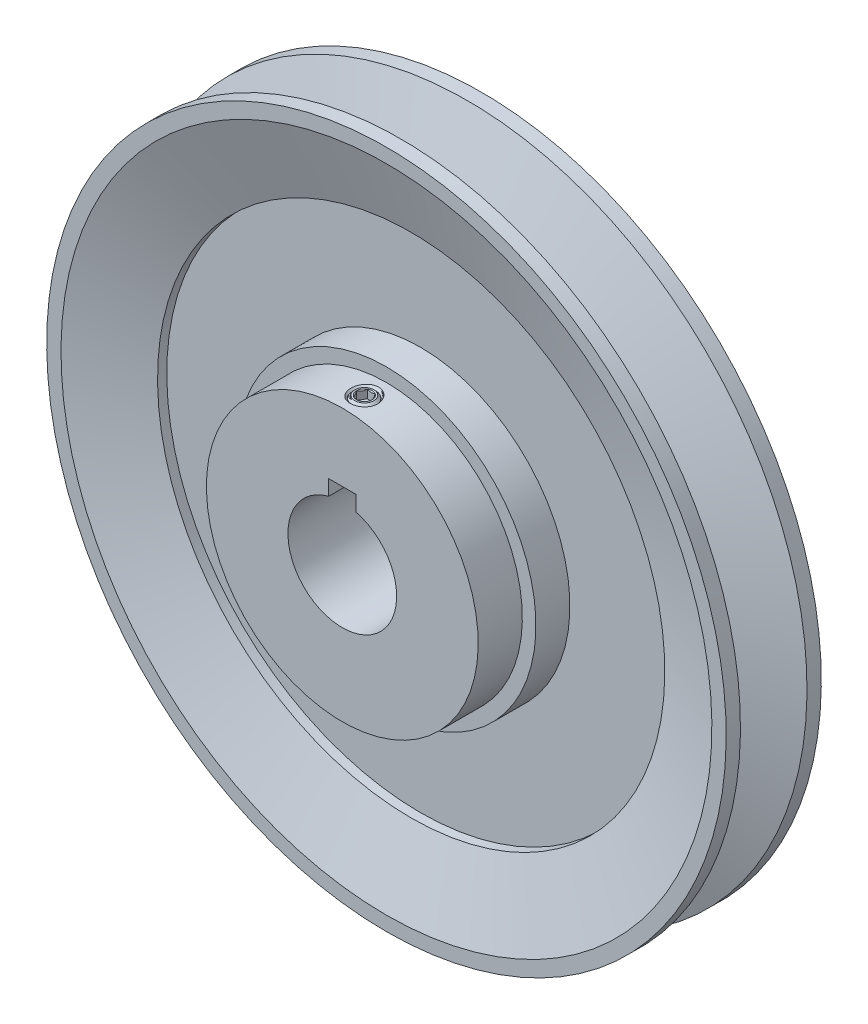
from build123d import *

# Parameters (mm, degrees)
SKETCH2_W          = 10.31875
SKETCH2_H          = 31.75
SKETCH3_R          = 12.7
CUT_EXTRUDE1_DEPTH = 32.5374
SKETCH4_W          = 6.35
SKETCH4_H          = 6.35
CUT_EXTRUDE2_DEPTH = 32.5374
SKETCH5_R          = 2.38125
CUT_EXTRUDE3_DEPTH = 31.75
CUT_SWEEP1_PITCH   = 1.27
CUT_SWEEP2_PITCH   = 1.27
CUT_EXTRUDE5_DEPTH = 1.984375


with BuildPart() as part:
    # Sketch1 → Revolve1 (revolve)
    with BuildSketch(Plane(origin=(0, 0, 0), x_dir=(0, 0, -1), z_dir=(1, 0, 0)), mode=Mode.PRIVATE) as revolve1_sk:
        Polygon((7.7724, 79.375), (11.1125, 79.375), (11.1125, 76.0349), (5.334525365, 59.254443213), (3.175, 59.254443213), (3.175, 34.925), (7.94385, 34.925), (7.94385, 0), (-11.1125, 0), (-11.1125, 34.925), (-3.175, 34.925), (-3.175, 59.254443213), (-5.334525365, 59.254443213), (-11.1125, 76.0349), (-11.1125, 79.375), (-7.7724, 79.375), (-2.306199139, 63.5), (2.306199139, 63.5), align=None)
    revolve(revolve1_sk.sketch.rotate(Axis((0, 0, 21.4249), (0, 0, -1)), 180), axis=Axis((0, 0, 21.4249), (0, 0, -1)))

    # Sketch2 → Revolve2 (revolve)
    with BuildSketch(Plane(origin=(0, 0, 0), x_dir=(0, 0, -1), z_dir=(1, 0, 0))):
        with Locations((-16.265525, 15.875)):
            Rectangle(SKETCH2_W, SKETCH2_H)
    revolve(axis=Axis((0, 0, -11.1125), (0, 0, 1)))

    # Sketch3 → Cut-Extrude1 (cut)
    with BuildSketch(Plane(origin=(0, 0, 21.4249), x_dir=(-1, 0, 0), z_dir=(0, 0, -1))):
        with Locations(Location((0, 0, 0), (0, 0, 270))):
            Circle(SKETCH3_R)
    extrude(amount=CUT_EXTRUDE1_DEPTH, mode=Mode.SUBTRACT)

    # Sketch4 → Cut-Extrude2 (cut)
    with BuildSketch(Plane(origin=(0, 0, 21.4249), x_dir=(-1, 0, 0), z_dir=(0, 0, -1))):
        with Locations((0, 12.7)):
            Rectangle(SKETCH4_W, SKETCH4_H)
    extrude(amount=CUT_EXTRUDE2_DEPTH, mode=Mode.SUBTRACT)

    # Sketch5 → Cut-Extrude3 (cut)
    with BuildSketch(Plane(origin=(0, 31.75, 0), x_dir=(-1, 0, 0), z_dir=(0, 1, 0))):
        with Locations(Location((0, 16.265525, 0), (0, 0, 270))):
            Circle(SKETCH5_R)
    extrude(amount=-CUT_EXTRUDE3_DEPTH, mode=Mode.SUBTRACT)

    # Cut-Sweep1: arcs per turn and ends read off the stored shape
    # Cut-Sweep1: the profile of Sketch7 screwed along a right-hand helix through 26 turns, 8 arcs to a turn; built about Z, then put on its axis
    cut_sweep1_z = Axis((0, 0, 0), (0, 0, 1))
    cut_sweep1_corners = [(2.281370036, 0, -1.2303125), (2.281370036, 0, -0.0396875), (3.175, 0, -0.555625), (3.175, 0, -0.714375)]
    with BuildLine(mode=Mode.PRIVATE) as cut_sweep1_profile:
        Line(cut_sweep1_corners[0], cut_sweep1_corners[1])
        Line(cut_sweep1_corners[1], cut_sweep1_corners[2])
        Line(cut_sweep1_corners[2], cut_sweep1_corners[3])
        Line(cut_sweep1_corners[3], cut_sweep1_corners[0])
    cut_sweep1_cap = Face(cut_sweep1_profile.wire())
    cut_sweep1_turn_angles = [0, 22.5, 45, 67.5, 90, 112.5, 135, 157.5, 180, 202.5, 225, 247.5, 270, 292.5, 315, 337.5, 360]
    cut_sweep1_turn_weights = [1, 0.9238795325112867, 1, 0.9238795325112867, 1, 0.9238795325112867, 1, 0.9238795325112867, 1, 0.9238795325112867, 1, 0.9238795325112867, 1, 0.9238795325112867, 1, 0.9238795325112867, 1]
    cut_sweep1_turn_rails = [Edge.make_bspline([Vector(p[0], p[1], 0).rotate(cut_sweep1_z, cut_sweep1_turn_angles[k]) / cut_sweep1_turn_weights[k] + Vector(0, 0, p[2] + CUT_SWEEP1_PITCH * cut_sweep1_turn_angles[k] / 360) for k in range(17)], [0, 0, 0, 1, 1, 2, 2, 3, 3, 4, 4, 5, 5, 6, 6, 7, 7, 8, 8, 8], 2, cut_sweep1_turn_weights) for p in cut_sweep1_corners]
    cut_sweep1_turn_sides = [Face.make_surface_from_curves(cut_sweep1_turn_rails[p[0]], cut_sweep1_turn_rails[p[1]]) for p in [(0, 1), (1, 2), (2, 3), (3, 0)]]
    cut_sweep1 = Plane(origin=(0, 31.75, 16.265525), x_dir=(0, 0, 1), z_dir=(0, -1, 0)) * Solid(Shell([*[p.moved(Location((0, 0, CUT_SWEEP1_PITCH * i))) for i in range(26) for p in cut_sweep1_turn_sides], cut_sweep1_cap, cut_sweep1_cap.rotate(cut_sweep1_z, 9360).moved(Location((0, 0, CUT_SWEEP1_PITCH * 9360 / 360)))]))
    add(cut_sweep1, mode=Mode.SUBTRACT)

    # Cut-Extrude4 cone 1 section (through the dimple's axis) → Cut-Extrude4 (revolve, cut)
    with BuildSketch(Plane(origin=(0, 31.75, 16.265525), x_dir=(0, 0, 1), z_dir=(1, 0, 0))):
        Polygon((0, 0), (3.312481533, 0), (0, 3.312481533), align=None)
    revolve(axis=Axis((0, 31.75, 16.265525), (0, -1, 0)), mode=Mode.SUBTRACT)


with BuildPart() as body_2:
    # Sketch9 → Revolve3 (revolve)
    with BuildSketch(Plane(origin=(0, 0, 0), x_dir=(0, 0, -1), z_dir=(1, 0, 0))):
        Polygon((-19.440525, 26.36237073), (-19.440525, 30.78762927), (-18.47815427, 31.75), (-16.265525, 31.75), (-16.265525, 25.4), (-18.47815427, 25.4), align=None)
    revolve(axis=Axis((0, 31.75, 16.265525), (0, -1, 0)))

    # Cut-Sweep2: arcs per turn and ends read off the stored shape
    # Cut-Sweep2: the profile of Sketch11 profile screwed along a right-hand helix through 6 turns, 8 arcs to a turn; built about Z, then put on its axis
    cut_sweep2_z = Axis((0, 0, 0), (0, 0, 1))
    cut_sweep2_corners = [(2.350110803, 0, -0.079375), (2.350110803, 0, 0.079375), (3.1753, 0, 0.555798205), (3.1753, 0, -0.555798205)]
    with BuildLine(mode=Mode.PRIVATE) as cut_sweep2_profile:
        Line(cut_sweep2_corners[0], cut_sweep2_corners[1])
        Line(cut_sweep2_corners[1], cut_sweep2_corners[2])
        Line(cut_sweep2_corners[2], cut_sweep2_corners[3])
        Line(cut_sweep2_corners[3], cut_sweep2_corners[0])
    cut_sweep2_cap = Face(cut_sweep2_profile.wire())
    cut_sweep2_turn_angles = [0, 22.5, 45, 67.5, 90, 112.5, 135, 157.5, 180, 202.5, 225, 247.5, 270, 292.5, 315, 337.5, 360]
    cut_sweep2_turn_weights = [1, 0.9238795325112867, 1, 0.9238795325112867, 1, 0.9238795325112867, 1, 0.9238795325112867, 1, 0.9238795325112867, 1, 0.9238795325112867, 1, 0.9238795325112867, 1, 0.9238795325112867, 1]
    cut_sweep2_turn_rails = [Edge.make_bspline([Vector(p[0], p[1], 0).rotate(cut_sweep2_z, cut_sweep2_turn_angles[k]) / cut_sweep2_turn_weights[k] + Vector(0, 0, p[2] + CUT_SWEEP2_PITCH * cut_sweep2_turn_angles[k] / 360) for k in range(17)], [0, 0, 0, 1, 1, 2, 2, 3, 3, 4, 4, 5, 5, 6, 6, 7, 7, 8, 8, 8], 2, cut_sweep2_turn_weights) for p in cut_sweep2_corners]
    cut_sweep2_turn_sides = [Face.make_surface_from_curves(cut_sweep2_turn_rails[p[0]], cut_sweep2_turn_rails[p[1]]) for p in [(0, 1), (1, 2), (2, 3), (3, 0)]]
    cut_sweep2 = Plane(origin=(0, 31.75, 16.265525), x_dir=(0, 0, 1), z_dir=(0, -1, 0)) * Solid(Shell([*[p.moved(Location((0, 0, CUT_SWEEP2_PITCH * i))) for i in range(6) for p in cut_sweep2_turn_sides], cut_sweep2_cap, cut_sweep2_cap.rotate(cut_sweep2_z, 2160).moved(Location((0, 0, CUT_SWEEP2_PITCH * 2160 / 360)))]))
    add(cut_sweep2, mode=Mode.SUBTRACT)

    # Sketch12 → Cut-Extrude5 (cut)
    with BuildSketch(Plane(origin=(0, 31.75, 0), x_dir=(1, 0, 0), z_dir=(0, 1, 0))):
        Polygon((1.833087105, -16.265525), (0.916543552, -14.678025), (-0.916543552, -14.678025), (-1.833087105, -16.265525), (-0.916543552, -17.853025), (0.916543552, -17.853025), align=None)
    extrude(amount=-CUT_EXTRUDE5_DEPTH, mode=Mode.SUBTRACT)

    # Cut-Extrude6 cone 1 section (through the dimple's axis) → Cut-Extrude6 (revolve, cut)
    with BuildSketch(Plane(origin=(0, 31.75, 16.265525), x_dir=(0, 0, 1), z_dir=(1, 0, 0))):
        Polygon((0, 0), (1.833087105, 0), (0, 1.833087105), align=None)
    revolve(axis=Axis((0, 31.75, 16.265525), (0, -1, 0)), mode=Mode.SUBTRACT)


solid = Compound([part.part, body_2.part])
